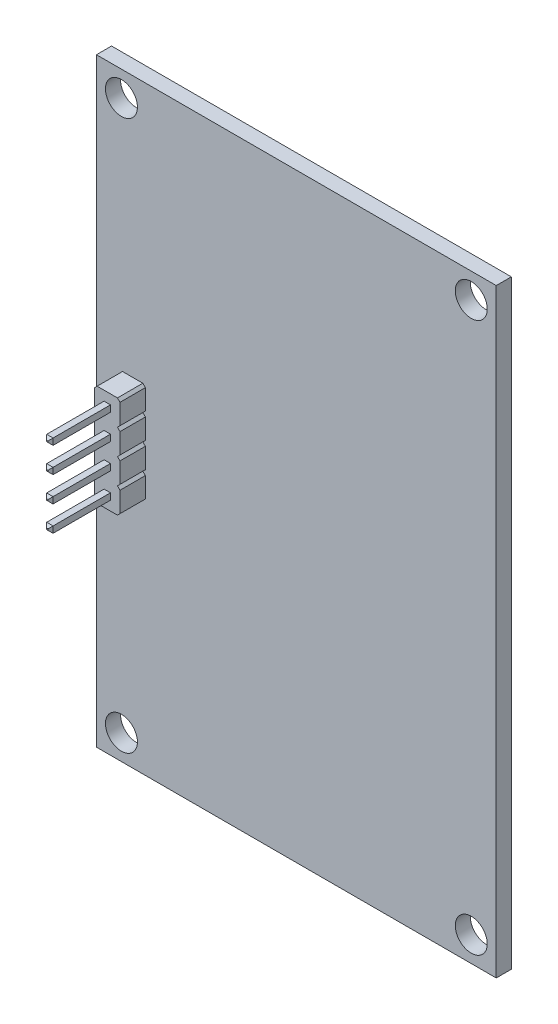
from build123d import *

# Parameters (mm, degrees)
SKETCH1_W                  = 10.16
SKETCH1_H                  = 2.54
BOSS_EXTRUDE1_DEPTH        = 2.54
CUT_EXTRUDE1_DEPTH         = 180.745209672
CUT_EXTRUDE2_DEPTH         = 180.745209672
CUT_EXTRUDE3_DEPTH         = 180.745209672
CUT_EXTRUDE4_DEPTH         = 180.745209672
CUT_EXTRUDE5_DEPTH         = 180.745209672
CUT_EXTRUDE6_DEPTH         = 180.745209672
SKETCH8_W                  = 0.64
SKETCH8_H                  = 0.64
BOSS_EXTRUDE2_DEPTH        = 6
SKETCH9_W                  = 0.64
SKETCH9_H                  = 0.64
BOSS_EXTRUDE3_DEPTH        = 6
SKETCH10_W                 = 0.64
SKETCH10_H                 = 0.64
BOSS_EXTRUDE4_DEPTH        = 6
SKETCH11_W                 = 0.64
SKETCH11_H                 = 0.64
BOSS_EXTRUDE5_DEPTH        = 6
SKETCH12_W                 = 0.64
SKETCH12_H                 = 0.64
BOSS_EXTRUDE6_DEPTH        = 3
SKETCH13_W                 = 0.64
SKETCH13_H                 = 0.64
BOSS_EXTRUDE7_DEPTH        = 3
SKETCH14_W                 = 0.64
SKETCH14_H                 = 0.64
BOSS_EXTRUDE8_DEPTH        = 3
SKETCH15_W                 = 0.64
SKETCH15_H                 = 0.64
BOSS_EXTRUDE9_DEPTH        = 3
DRAFT1_ANGLE               = 45
DRAFT2_ANGLE               = 45
DRAFT3_ANGLE               = 45
DRAFT4_ANGLE               = 45
CHAMFER1_SIZE              = 0.254
BOSS_EXTRUDE10_START       = -1.51
BOSS_EXTRUDE10_OUTLINE_W   = 40
BOSS_EXTRUDE10_OUTLINE_H   = 60
BOSS_EXTRUDE10_OUTLINE_R   = 1.6
BOSS_EXTRUDE10_OUTLINE_R_2 = 0.5
BOSS_EXTRUDE10_DEPTH       = 1.51
BOSS_EXTRUDE10_START_2     = -1.5
BOSS_EXTRUDE10_2_OUTLINE_R = 1.6
BOSS_EXTRUDE10_2_DEPTH     = 1.5
SKETCH18_R                 = 1.6
CUT_EXTRUDE8_DEPTH         = 223.203489228


# Read off the part's stored shape, not the designer's step: Boss-Extrude10
with BuildPart() as part:
    # Sketch1 → Boss-Extrude1 (new body)
    with BuildSketch(Plane(origin=(142.44, 0, 0), x_dir=(0, -1, 0), z_dir=(-1, 0, 0))):
        with Locations((101.14, 2.865)):
            Rectangle(SKETCH1_W, SKETCH1_H)
    extrude(amount=-BOSS_EXTRUDE1_DEPTH)

    # Sketch2 → Cut-Extrude1 (cut, through all)
    with BuildSketch(Plane(origin=(0, 0, 1.595), x_dir=(-1, 0, 0), z_dir=(0, 0, -1))):
        Polygon((-144.98, -103.426), (-144.98, -103.934), (-144.472, -103.934), align=None)
    extrude(amount=-CUT_EXTRUDE1_DEPTH, mode=Mode.SUBTRACT)

    # Sketch3 → Cut-Extrude2 (cut, through all)
    with BuildSketch(Plane(origin=(0, 0, 1.595), x_dir=(-1, 0, 0), z_dir=(0, 0, -1))):
        Polygon((-144.98, -100.886), (-144.98, -101.394), (-144.472, -100.886), align=None)
    extrude(amount=-CUT_EXTRUDE2_DEPTH, mode=Mode.SUBTRACT)

    # Sketch4 → Cut-Extrude3 (cut, through all)
    with BuildSketch(Plane(origin=(0, 0, 1.595), x_dir=(-1, 0, 0), z_dir=(0, 0, -1))):
        Polygon((-144.98, -98.346), (-144.98, -98.854), (-144.472, -98.854), align=None)
    extrude(amount=-CUT_EXTRUDE3_DEPTH, mode=Mode.SUBTRACT)

    # Sketch5 → Cut-Extrude4 (cut, through all)
    with BuildSketch(Plane(origin=(0, 0, 1.595), x_dir=(-1, 0, 0), z_dir=(0, 0, -1))):
        Polygon((-142.44, -98.854), (-142.44, -98.346), (-142.948, -98.854), align=None)
    extrude(amount=-CUT_EXTRUDE4_DEPTH, mode=Mode.SUBTRACT)

    # Sketch6 → Cut-Extrude5 (cut, through all)
    with BuildSketch(Plane(origin=(0, 0, 1.595), x_dir=(-1, 0, 0), z_dir=(0, 0, -1))):
        Polygon((-142.44, -101.394), (-142.44, -100.886), (-142.948, -100.886), align=None)
    extrude(amount=-CUT_EXTRUDE5_DEPTH, mode=Mode.SUBTRACT)

    # Sketch7 → Cut-Extrude6 (cut, through all)
    with BuildSketch(Plane(origin=(0, 0, 1.595), x_dir=(-1, 0, 0), z_dir=(0, 0, -1))):
        Polygon((-142.44, -103.934), (-142.44, -103.426), (-142.948, -103.934), align=None)
    extrude(amount=-CUT_EXTRUDE6_DEPTH, mode=Mode.SUBTRACT)

    # Sketch8 → Boss-Extrude2 (add)
    with BuildSketch(Plane.XY.offset(4.135)):
        with Locations((143.71, -102.41)):
            Rectangle(SKETCH8_W, SKETCH8_H)
    extrude(amount=BOSS_EXTRUDE2_DEPTH)

    # Sketch9 → Boss-Extrude3 (add)
    with BuildSketch(Plane.XY.offset(4.135)):
        with Locations((143.71, -104.95)):
            Rectangle(SKETCH9_W, SKETCH9_H)
    extrude(amount=BOSS_EXTRUDE3_DEPTH)

    # Sketch10 → Boss-Extrude4 (add)
    with BuildSketch(Plane.XY.offset(4.135)):
        with Locations((143.71, -97.33)):
            Rectangle(SKETCH10_W, SKETCH10_H)
    extrude(amount=BOSS_EXTRUDE4_DEPTH)

    # Sketch11 → Boss-Extrude5 (add)
    with BuildSketch(Plane.XY.offset(4.135)):
        with Locations((143.71, -99.87)):
            Rectangle(SKETCH11_W, SKETCH11_H)
    extrude(amount=BOSS_EXTRUDE5_DEPTH)

    # Sketch12 → Boss-Extrude6 (add)
    with BuildSketch(Plane(origin=(0, 0, 1.595), x_dir=(-1, 0, 0), z_dir=(0, 0, -1))):
        with Locations((-143.71, -102.41)):
            Rectangle(SKETCH12_W, SKETCH12_H)
    extrude(amount=BOSS_EXTRUDE6_DEPTH)

    # Sketch13 → Boss-Extrude7 (add)
    with BuildSketch(Plane(origin=(0, 0, 1.595), x_dir=(-1, 0, 0), z_dir=(0, 0, -1))):
        with Locations((-143.71, -104.95)):
            Rectangle(SKETCH13_W, SKETCH13_H)
    extrude(amount=BOSS_EXTRUDE7_DEPTH)

    # Sketch14 → Boss-Extrude8 (add)
    with BuildSketch(Plane(origin=(0, 0, 1.595), x_dir=(-1, 0, 0), z_dir=(0, 0, -1))):
        with Locations((-143.71, -97.33)):
            Rectangle(SKETCH14_W, SKETCH14_H)
    extrude(amount=BOSS_EXTRUDE8_DEPTH)

    # Sketch15 → Boss-Extrude9 (add)
    with BuildSketch(Plane(origin=(0, 0, 1.595), x_dir=(-1, 0, 0), z_dir=(0, 0, -1))):
        with Locations((-143.71, -99.87)):
            Rectangle(SKETCH15_W, SKETCH15_H)
    extrude(amount=BOSS_EXTRUDE9_DEPTH)

    # Draft1
    draft1_faces = [part.faces().sort_by_distance(p)[0] for p in [
        (144.726, -103.934, 2.865),
    ]]
    draft(draft1_faces, Plane(origin=(144.98, 0, 0), x_dir=(0, 0, 1), z_dir=(1, 0, 0)), DRAFT1_ANGLE)

    # Draft2
    draft2_faces = [part.faces().sort_by_distance(p)[0] for p in [
        (142.694, -103.934, 2.865),
    ]]
    draft(draft2_faces, Plane(origin=(142.44, 0, 0), x_dir=(0, 0, -1), z_dir=(-1, 0, 0)), DRAFT2_ANGLE)

    # Draft3
    draft3_faces = [part.faces().sort_by_distance(p)[0] for p in [
        (144.726, -100.886, 2.865),
        (144.726, -98.854, 2.865),
    ]]
    draft(draft3_faces, Plane(origin=(144.98, 0, 0), x_dir=(0, 0, 1), z_dir=(1, 0, 0)), DRAFT3_ANGLE)

    # Draft4
    draft4_faces = [part.faces().sort_by_distance(p)[0] for p in [
        (142.694, -98.854, 2.865),
        (142.694, -100.886, 2.865),
    ]]
    draft(draft4_faces, Plane(origin=(142.44, 0, 0), x_dir=(0, 0, -1), z_dir=(-1, 0, 0)), DRAFT4_ANGLE)

    # Chamfer1
    chamfer1_edges = [part.edges().sort_by_distance(p)[0] for p in [
        (143.71, -102.09, 10.135),
        (143.39, -102.41, 10.135),
        (143.71, -102.73, 10.135),
        (144.03, -102.41, 10.135),
        (143.71, -104.63, 10.135),
        (143.39, -104.95, 10.135),
        (143.71, -105.27, 10.135),
        (144.03, -104.95, 10.135),
        (144.98, -106.22, 2.865),
        (143.71, -97.01, 10.135),
        (143.39, -97.33, 10.135),
        (143.71, -97.65, 10.135),
        (144.03, -97.33, 10.135),
        (143.39, -99.87, 10.135),
        (143.71, -100.19, 10.135),
        (144.03, -99.87, 10.135),
        (143.71, -99.55, 10.135),
        (143.71, -102.73, -1.405),
        (143.39, -102.41, -1.405),
        (143.71, -102.09, -1.405),
        (144.03, -102.41, -1.405),
        (143.39, -104.95, -1.405),
        (143.71, -104.63, -1.405),
        (144.03, -104.95, -1.405),
        (143.71, -105.27, -1.405),
        (143.39, -97.33, -1.405),
        (143.71, -97.01, -1.405),
        (144.03, -97.33, -1.405),
        (143.71, -97.65, -1.405),
        (143.71, -100.19, -1.405),
        (143.39, -99.87, -1.405),
        (143.71, -99.55, -1.405),
        (144.03, -99.87, -1.405),
        (144.98, -96.06, 2.865),
        (142.44, -106.22, 2.865),
        (142.44, -96.06, 2.865),
    ]]
    chamfer(chamfer1_edges, length=CHAMFER1_SIZE)


with BuildPart() as body_2:
    # Boss-Extrude10 outline → Boss-Extrude10 (new body)
    with BuildSketch(Plane.XY.offset(1.51).offset(BOSS_EXTRUDE10_START)):
        with Locations((160, -100)):
            Rectangle(BOSS_EXTRUDE10_OUTLINE_W, BOSS_EXTRUDE10_OUTLINE_H)
        with Locations((142.5, -127.5)):
            Circle(BOSS_EXTRUDE10_OUTLINE_R, mode=Mode.SUBTRACT)
        with Locations((143.71, -104.95)):
            Circle(BOSS_EXTRUDE10_OUTLINE_R_2, mode=Mode.SUBTRACT)
        with Locations((143.71, -102.41)):
            Circle(BOSS_EXTRUDE10_OUTLINE_R_2, mode=Mode.SUBTRACT)
        with Locations((177.5, -127.5)):
            Circle(BOSS_EXTRUDE10_OUTLINE_R, mode=Mode.SUBTRACT)
        with Locations((143.71, -99.87)):
            Circle(BOSS_EXTRUDE10_OUTLINE_R_2, mode=Mode.SUBTRACT)
        with Locations((143.71, -97.33)):
            Circle(BOSS_EXTRUDE10_OUTLINE_R_2, mode=Mode.SUBTRACT)
        with Locations((142.5, -72.5)):
            Circle(BOSS_EXTRUDE10_OUTLINE_R, mode=Mode.SUBTRACT)
        with Locations((177.5, -73)):
            Circle(BOSS_EXTRUDE10_OUTLINE_R, mode=Mode.SUBTRACT)
    extrude(amount=BOSS_EXTRUDE10_DEPTH)

    # Boss-Extrude10 2 outline → Boss-Extrude10 2 (add)
    with BuildSketch(Plane.XY.offset(1.51).offset(BOSS_EXTRUDE10_START_2)):
        with Locations((177.5, -73)):
            Circle(BOSS_EXTRUDE10_2_OUTLINE_R)
    extrude(amount=BOSS_EXTRUDE10_2_DEPTH)

    # Sketch18 → Cut-Extrude8 (cut, through all)
    with BuildSketch(Plane.XY.offset(1.51)):
        with Locations((177.5, -72.5)):
            Circle(SKETCH18_R)
    extrude(amount=-CUT_EXTRUDE8_DEPTH, mode=Mode.SUBTRACT)


solid = Compound([part.part, body_2.part])
